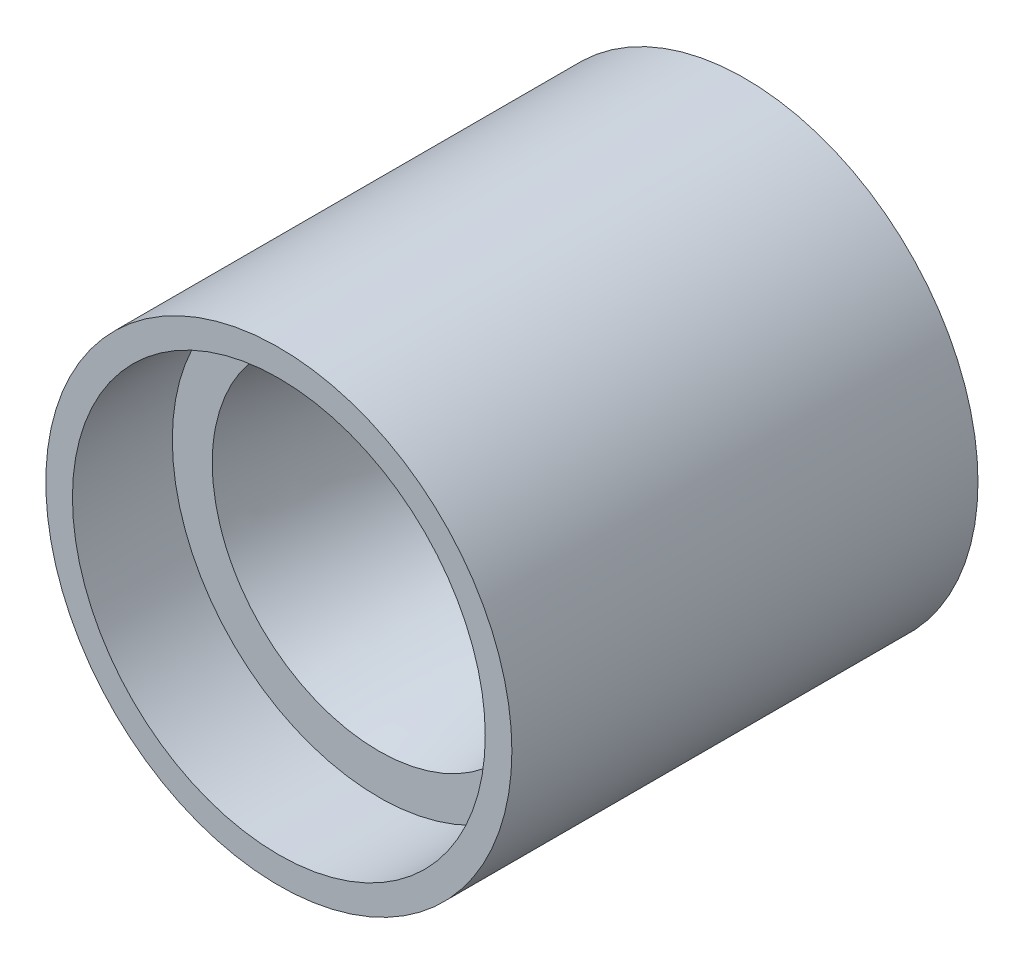
from build123d import *

# Parameters (mm, degrees)
CROQUIS1_R              = 35
CROQUIS1_R_2            = 31
SALIENTE_EXTRUIR1_DEPTH = 70
CROQUIS2_R              = 31
SALIENTE_EXTRUIR2_DEPTH = 55


with BuildPart() as part:
    # Croquis1 → Saliente-Extruir1 (new body)
    with BuildSketch(Plane.XY):
        Circle(CROQUIS1_R)
        Circle(CROQUIS1_R_2, mode=Mode.SUBTRACT)
    extrude(amount=SALIENTE_EXTRUIR1_DEPTH)

    # Croquis2 → Saliente-Extruir2 (add)
    with BuildSketch(Plane(origin=(0, 0, 0), x_dir=(-1, 0, 0), z_dir=(0, 0, -1))):
        Circle(CROQUIS2_R)
    extrude(amount=-SALIENTE_EXTRUIR2_DEPTH)

    # Cortar-Recubrir2: read off the stored shape, not the designer's step
    # Cortar-Recubrir2: loft between two sections, ruled curve by curve
    cortar_recubrir2_from = [
        Edge.make_bspline([(24.505743897, 4.946566089, 55), (34.398876075, -44.064921704, 55), (-14.612611719, -53.958053882, 55), (-24.505743897, -4.946566089, 55), (-34.398876075, 44.064921704, 55), (14.612611719, 53.958053882, 55), (24.505743897, 4.946566089, 55)], [0, 0, 0, 0, 0.5, 0.5, 0.5, 1, 1, 1, 1], 3, [1, 0.333333333, 0.333333333, 1, 0.333333333, 0.333333333, 1]),
    ]
    cortar_recubrir2_to = [
        Edge.make_bspline([(10.528812483, 15.875975803, 0), (42.280764089, -5.181649163, 0), (21.223139123, -36.933600769, 0), (-10.528812483, -15.875975803, 0), (-42.280764089, 5.181649163, 0), (-21.223139123, 36.933600769, 0), (10.528812483, 15.875975803, 0)], [0, 0, 0, 0, 0.5, 0.5, 0.5, 1, 1, 1, 1], 3, [1, 0.333333333, 0.333333333, 1, 0.333333333, 0.333333333, 1]),
    ]
    cortar_recubrir2 = Solid(Shell([*[Face.make_surface_from_curves(cortar_recubrir2_from[k], cortar_recubrir2_to[k]) for k in range(1)], Face(Wire(cortar_recubrir2_from)), Face(Wire(cortar_recubrir2_to))]))
    add(cortar_recubrir2, mode=Mode.SUBTRACT)


solid = part.part
